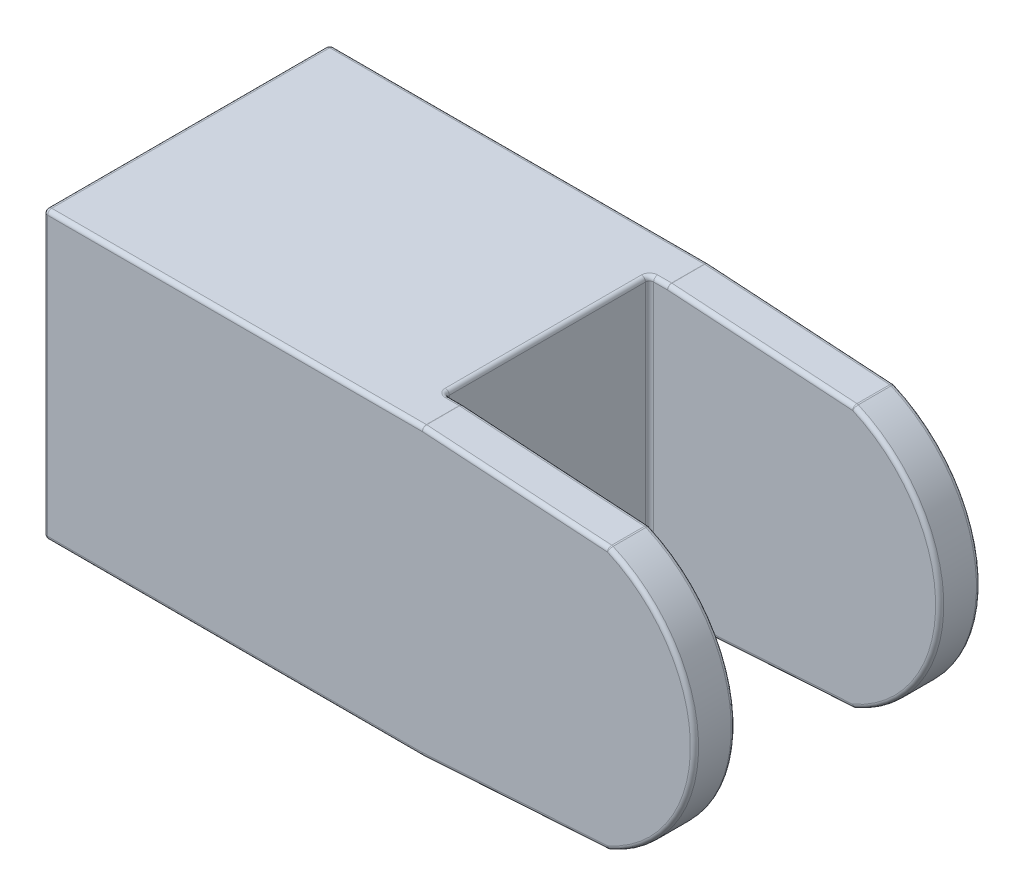
from build123d import *

# Parameters (mm, degrees)
BOSS_EXTRUDE1_DEPTH = 35
CUT_EXTRUDE1_DEPTH  = 70
CUT_EXTRUDE2_START  = -70
CUT_EXTRUDE2_DEPTH  = 70
FILLET3_R           = 1


# Read off the part's stored shape, not the designer's step: Cut-Extrude2
with BuildPart() as part:
    # Sketch2 → Boss-Extrude1 (new, symmetric)
    with BuildSketch(Plane(origin=(0, 0, 0), x_dir=(1, 0, 0), z_dir=(0, 1, 0))):
        Polygon((0, 0), (0, 70), (159.267236843, 70), (159.267236843, 60), (88.267236843, 60), (88.267236843, 10), (159.267236843, 10), (159.267236843, 0), align=None)
    extrude(amount=BOSS_EXTRUDE1_DEPTH, both=True)

    # Sketch3 → Cut-Extrude1 (cut)
    with BuildSketch(Plane.XY):
        Polygon((92.712686328, 35), (159.267236843, 30.767300383), (159.267236843, 35), align=None)
        Polygon((92.712686328, -35), (159.267236843, -30.767300383), (159.267236843, -35), align=None)
    extrude(amount=-CUT_EXTRUDE1_DEPTH, mode=Mode.SUBTRACT)

    # Cut-Extrude2 outline → Cut-Extrude2 (cut)
    with BuildSketch(Plane.XY.offset(CUT_EXTRUDE2_START)):
        with BuildLine():
            Line((159.267236843, 30.767300383), (138.20045286, 32.107094098))
            ThreePointArc((138.20045286, 32.107094098), (153.530375436, 19.200747894), (159.267236843, 0))
            Line((159.267236843, 0), (159.267236843, 30.767300383))
        make_face()
        with BuildLine():
            Line((159.267236843, -30.767300383), (159.267236843, 0))
            ThreePointArc((159.267236843, 0), (153.530375436, -19.200747894), (138.20045286, -32.107094098))
            Line((138.20045286, -32.107094098), (159.267236843, -30.767300383))
        make_face()
    extrude(amount=CUT_EXTRUDE2_DEPTH, mode=Mode.SUBTRACT)

    # Fillet3
    fillet3_edges = [part.edges().sort_by_distance(p)[0] for p in [
        (88.267236843, -35, -35),
        (46.356343164, -35, 0),
        (0, 0, 0),
        (0, 0, -70),
        (88.267236843, 0, -60),
        (88.267236843, 0, -10),
        (88.267236843, 35, -35),
        (90.489961586, 35, -60),
        (46.356343164, -35, -70),
        (90.489961586, -35, -10),
        (92.712686328, -35, -5),
        (90.489961586, 35, -10),
        (46.356343164, 35, -70),
        (92.712686328, 35, -5),
        (0, 35, -35),
        (92.712686328, 35, -65),
        (115.456569594, 33.553547049, -10),
        (115.456569594, 33.553547049, -70),
        (115.456569594, 33.553547049, 0),
        (92.712686328, -35, -65),
        (115.456569594, -33.553547049, -60),
        (46.356343164, 35, 0),
        (138.20045286, 32.107094098, -5),
        (115.456569594, 33.553547049, -60),
        (115.456569594, -33.553547049, 0),
        (115.456569594, -33.553547049, -10),
        (115.456569594, -33.553547049, -70),
        (153.530375436, -19.200747894, -60),
        (138.20045286, -32.107094098, -65),
        (153.530375436, 19.200747894, -70),
        (138.20045286, -32.107094098, -5),
        (153.530375436, 19.200747894, -10),
        (138.20045286, 32.107094098, -65),
        (153.530375436, 19.200747894, 0),
        (0, -35, -35),
        (90.489961586, -35, -60),
    ]]
    fillet(fillet3_edges, radius=FILLET3_R)


with BuildPart() as part_1:
    # Body-Move/Copy1: moved
    add(part.part.moved(Location((0, 0, 35))))


solid = part_1.part
